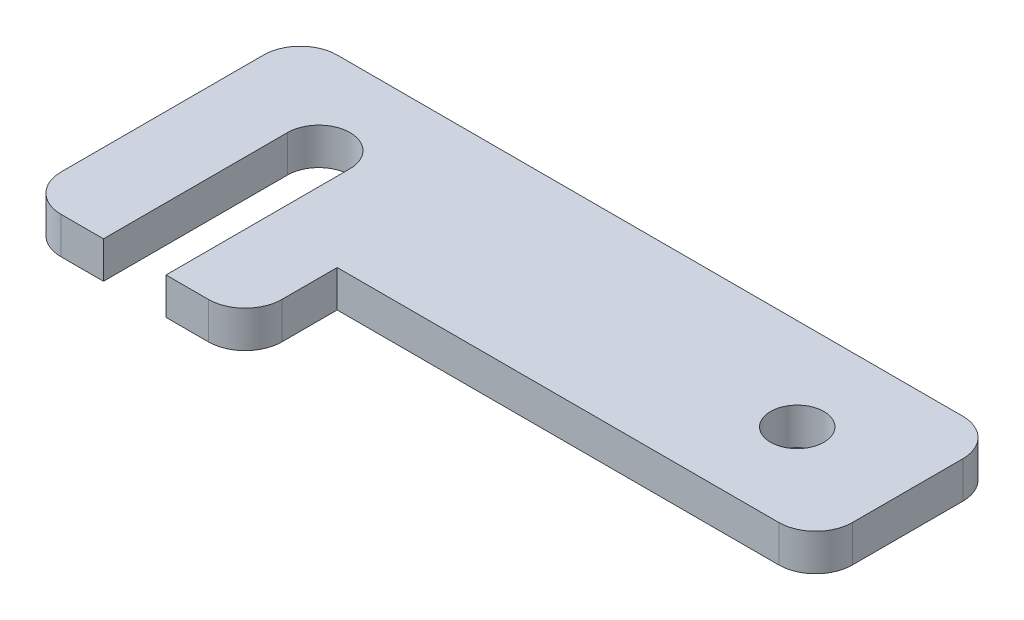
from build123d import *

# Parameters (mm, degrees)
SKETCH_1_W             = 38
SKETCH_1_H             = 2
SM_BASE_FLANGE_1_DEPTH = 15
CUT_EXTRUDE_1_REACH    = 26.29
SKETCH_6_W             = 26
SKETCH_6_H             = 5
HOLE_WIZARD_M2_5_1_D   = 2.9
CUT_EXTRUDE_2_REACH    = 26.29
FILLET_1_R             = 2


# Sheet-metal steps are written as plain solids
with BuildPart() as part:
    # Sketch 1 → ﾍﾞｰｽ-ﾌﾗﾝｼﾞ1 (new body)
    with BuildSketch(Plane.XY):
        with Locations((0, -1)):
            Rectangle(SKETCH_1_W, SKETCH_1_H)
    extrude(amount=SM_BASE_FLANGE_1_DEPTH)

    # ｽｹｯﾁ6 → ｶｯﾄ - 押し出し1 (cut, up to next)
    with BuildSketch(Plane(origin=(0, 0, 0), x_dir=(1, 0, 0), z_dir=(0, 1, 0)), mode=Mode.PRIVATE) as cut_extrude_1_sk1:
        with Locations((6, -12.5)):
            Rectangle(SKETCH_6_W, SKETCH_6_H)
    cut_extrude_1_tool1 = extrude(cut_extrude_1_sk1.sketch, amount=-CUT_EXTRUDE_1_REACH, mode=Mode.PRIVATE) & part.part
    add(cut_extrude_1_tool1.solids().sort_by_distance((6, 0, 12.5))[0], mode=Mode.SUBTRACT)

    # M2.5 すきま穴1 (through all)
    with Locations(Plane(origin=(0, 0, 0), x_dir=(1, 0, 0), z_dir=(0, 1, 0))):
        with Locations((13, -5)):
            Hole(HOLE_WIZARD_M2_5_1_D / 2)

    # ｽｹｯﾁ9 → ｶｯﾄ - 押し出し2 (cut, up to next)
    with BuildSketch(Plane(origin=(0, 0, 0), x_dir=(1, 0, 0), z_dir=(0, 1, 0)), mode=Mode.PRIVATE) as cut_extrude_2_sk1:
        with BuildLine():
            Line((-11.3, -5), (-11.3, -15))
            ThreePointArc((-11.3, -15), (-13, -16.7), (-14.7, -15))
            Line((-14.7, -15), (-14.7, -5))
            ThreePointArc((-14.7, -5), (-13, -3.3), (-11.3, -5))
        make_face()
    cut_extrude_2_tool1 = extrude(cut_extrude_2_sk1.sketch, amount=-CUT_EXTRUDE_2_REACH, mode=Mode.PRIVATE) & part.part
    add(cut_extrude_2_tool1.solids().sort_by_distance((-13, 0, 10))[0], mode=Mode.SUBTRACT)

    # ﾌｨﾚｯﾄ1
    fillet_1_edges = [part.edges().sort_by_distance(p)[0] for p in [
        (-19, -1, 15),
        (19, -1, 10),
        (-7, -1, 15),
        (-19, -1, 0),
        (19, -1, 0),
    ]]
    fillet(fillet_1_edges, radius=FILLET_1_R)


solid = part.part
